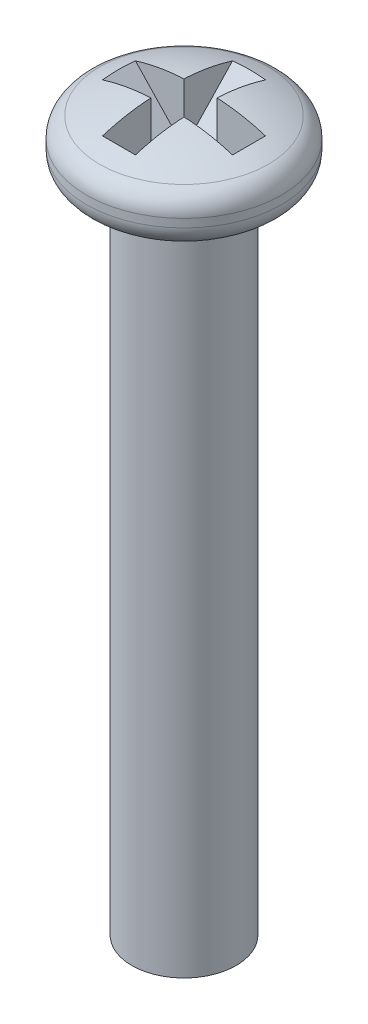
from build123d import *

# Parameters (mm, degrees)
CUT_EXTRUDE_1_DEPTH      = 0.3
PATTERN_CIRCULAR_1_COUNT = 2
PATTERN_CIRCULAR_1_ANGLE = 90


with BuildPart() as part:
    # 草图1 → 旋转3 (revolve)
    with BuildSketch(Plane(origin=(0, 0, 0), x_dir=(0, 0, -1), z_dir=(1, 0, 0)), mode=Mode.PRIVATE) as revolve_3_sk:
        with BuildLine():
            ThreePointArc((1.375, -1.2), (1.657842712, -1.082842712), (1.775, -0.8))
            Line((1.775, -0.8), (1.775, -0.649888064))
            ThreePointArc((1.775, -0.649888064), (1.709909462, -0.431174433), (1.535821739, -0.283641742))
            ThreePointArc((1.535821739, -0.283641742), (0.784373982, -0.052678823), (0, 0))
            Line((0, 0), (0, -13.2))
            Line((0, -13.2), (0.95, -13.2))
            Line((0.95, -13.2), (0.95, -1.2))
            Line((0.95, -1.2), (1.375, -1.2))
        make_face()
    revolve(revolve_3_sk.sketch.rotate(Axis((0, 0, 0), (0, -1, 0)), 180), axis=Axis((0, 0, 0), (0, -1, 0)))

    # 草图5 → 切除-拉伸1 (cut, symmetric)
    with BuildSketch(Plane(origin=(0, 0, 0), x_dir=(0, 0, -1), z_dir=(1, 0, 0))):
        Polygon((-1.8, 0.488536713), (-0.5, -0.8838523), (0.5, -0.8838523), (1.8, 0.488536713), align=None)
    cut_extrude_1 = extrude(amount=CUT_EXTRUDE_1_DEPTH, both=True, mode=Mode.SUBTRACT)

    # 阵列(圆周)1: 切除-拉伸1 ×2 about axis
    pattern_circular_1_axis = Axis((0, 0, 0), (0, -1, 0))
    for i in range(1, PATTERN_CIRCULAR_1_COUNT):
        add(cut_extrude_1.rotate(pattern_circular_1_axis, i * PATTERN_CIRCULAR_1_ANGLE / (PATTERN_CIRCULAR_1_COUNT - 1)), mode=Mode.SUBTRACT)


solid = part.part
